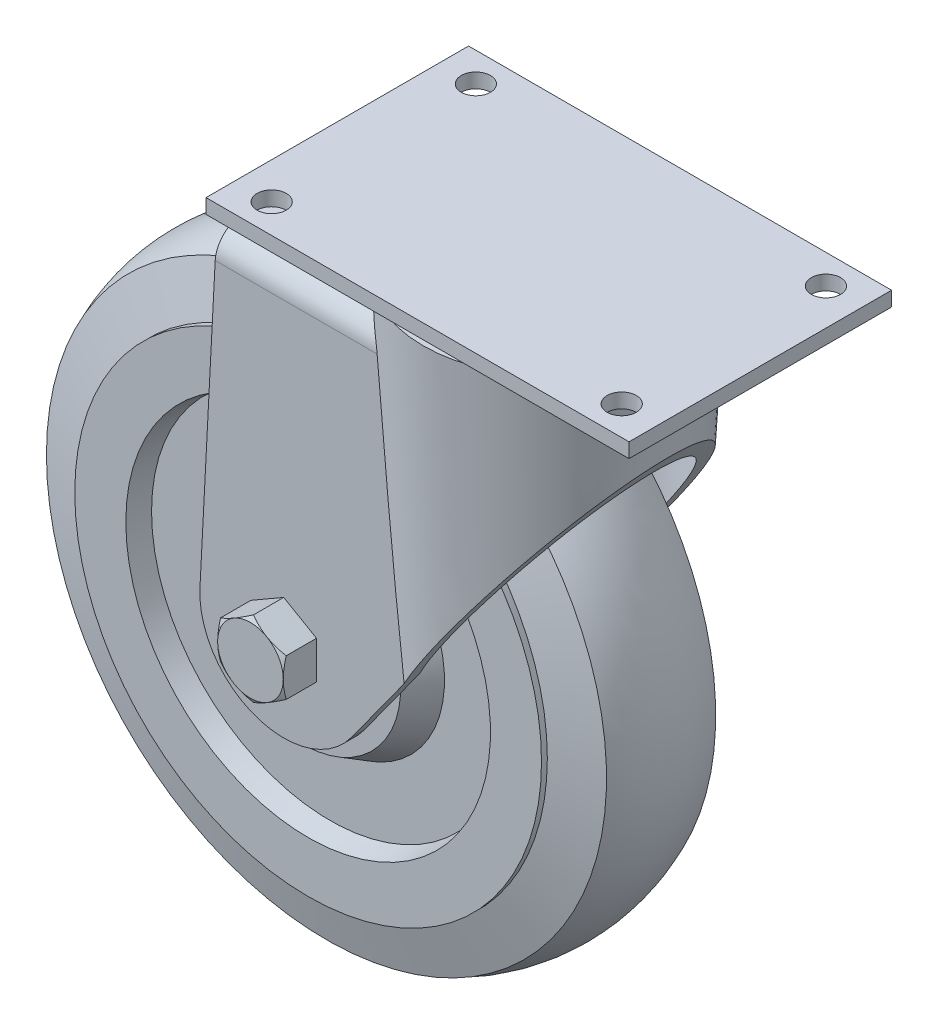
from build123d import *

# Parameters (mm, degrees)
SKETCH4_W           = 92.075
SKETCH4_H           = 57.15
SKETCH4_R           = 3.175
BOSS_EXTRUDE1_DEPTH = 3.175
SKETCH5_W           = 1.778
SKETCH5_H           = 1.143
SKETCH6_R           = 27.330023288
BOSS_EXTRUDE2_DEPTH = 140.5001
BOSS_EXTRUDE2_TAPER = 3
SKETCH8_W           = 61.093730444
SKETCH8_H           = 134.1501
BOSS_EXTRUDE3_DEPTH = 21.193125
FILLET2_R           = 6.35
SHELL1_START        = -58.315605444
SHELL1_DEPTH        = 55.537480444
CUT_EXTRUDE1_START  = -24.369939
CUT_EXTRUDE1_DEPTH  = 48.739878
SKETCH10_R          = 6.35
BOSS_EXTRUDE4_DEPTH = 39.608125
BOSS_EXTRUDE5_DEPTH = 7.239
SKETCH12_OUTSIDE_W  = 838.575
SKETCH12_OUTSIDE_H  = 838.576
SKETCH12_OUTSIDE_R  = 7.14375
CUT_EXTRUDE2_DEPTH  = 186.964821905
CUT_EXTRUDE2_DRAFT  = -60


with BuildPart() as part:
    # Sketch3 → Revolve1 (revolve)
    with BuildSketch(Plane(origin=(-36.5125, 0, 0), x_dir=(0, 0, -1), z_dir=(1, 0, 0)), mode=Mode.PRIVATE) as revolve1_sk:
        with BuildLine():
            Line((-17.145, -82.55), (-17.145, -61.11875))
            Line((-17.145, -61.11875), (-11.1125, -57.635884501))
            Line((-11.1125, -57.635884501), (-11.1125, -43.702257246))
            Line((-11.1125, -43.702257246), (-15.875, -42.8625))
            Line((-15.875, -42.8625), (-15.875, -31.75))
            Line((-15.875, -31.75), (-14.605, -31.75))
            Line((-14.605, -31.75), (-11.882636205, -21.59))
            ThreePointArc((-11.882636205, -21.59), (0, -19.05), (11.882636205, -21.59))
            Line((11.882636205, -21.59), (14.605, -31.75))
            Line((14.605, -31.75), (15.875, -31.75))
            Line((15.875, -31.75), (15.875, -42.8625))
            Line((15.875, -42.8625), (11.1125, -43.702257246))
            Line((11.1125, -43.702257246), (11.1125, -57.635884501))
            Line((11.1125, -57.635884501), (17.145, -61.11875))
            Line((17.145, -61.11875), (17.145, -82.55))
            Line((17.145, -82.55), (-17.145, -82.55))
        make_face()
    revolve(revolve1_sk.sketch.rotate(Axis((-36.5125, -82.55, 17.145), (0, 0, 1)), 90), axis=Axis((-36.5125, -82.55, 17.145), (0, 0, 1)))


with BuildPart() as body_2:
    # Sketch4 → Boss-Extrude1 (new body)
    with BuildSketch(Plane(origin=(0, 0, 0), x_dir=(1, 0, 0), z_dir=(0, 1, 0))):
        Rectangle(SKETCH4_W, SKETCH4_H)
        with Locations(Location((38.1, 22.225, 0), (0, 0, 270))):
            Circle(SKETCH4_R, mode=Mode.SUBTRACT)
        with Locations(Location((-38.1, 22.225, 0), (0, 0, 90))):
            Circle(SKETCH4_R, mode=Mode.SUBTRACT)
        with Locations(Location((38.1, -22.225, 0), (0, 0, 90))):
            Circle(SKETCH4_R, mode=Mode.SUBTRACT)
        with Locations(Location((-38.1, -22.225, 0), (0, 0, 270))):
            Circle(SKETCH4_R, mode=Mode.SUBTRACT)
    extrude(amount=-BOSS_EXTRUDE1_DEPTH)

    # Sketch5 → Revolve2 (revolve)
    with BuildSketch(Plane.XY, mode=Mode.PRIVATE) as revolve2_sk:
        with BuildLine():
            Line((0, -5.5499), (24.790023288, -5.5499))
            ThreePointArc((24.790023288, -5.5499), (23.047322881, -3.811221335), (20.66925, -3.175))
            Line((20.66925, -3.175), (0, -3.175))
            Line((0, -3.175), (0, -5.5499))
        make_face()
        with Locations((24.54275, -10.033)):
            Rectangle(SKETCH5_W, SKETCH5_H)
    revolve(revolve2_sk.sketch.rotate(Axis((0, -3.175, 0), (0, -1, 0)), 180), axis=Axis((0, -3.175, 0), (0, -1, 0)))


with BuildPart() as revolve2_piece_1:
    # of the separate pieces the step leaves, piece 1, a body of its own (revolve2_pieces)
    add(body_2.part.solids().sort_by_distance((-46.0375, 0, -28.575))[0])


with BuildPart() as revolve2_piece_2:
    # of the separate pieces the step leaves, piece 2, a body of its own (revolve2_pieces)
    add(body_2.part.solids().sort_by_distance((-25.43175, -10.6045, 0))[0])


with BuildPart() as body_4:
    # Sketch6 → Boss-Extrude2 (new body)
    with BuildSketch(Plane.XZ.offset(5.5499)):
        Circle(SKETCH6_R)
    extrude(amount=BOSS_EXTRUDE2_DEPTH, taper=BOSS_EXTRUDE2_TAPER)


with BuildPart() as body_5:
    # Sketch8 → Boss-Extrude3 (new, symmetric)
    with BuildSketch(Plane.XY):
        with Locations((-30.546865222, -78.97495)):
            Rectangle(SKETCH8_W, SKETCH8_H)
    extrude(amount=BOSS_EXTRUDE3_DEPTH, both=True)

    # Fillet2
    fillet2_edges = [body_5.edges().sort_by_distance(p)[0] for p in [
        (-30.546865222, -11.8999, 21.193125),
        (-30.546865222, -11.8999, -21.193125),
    ]]
    fillet(fillet2_edges, radius=FILLET2_R)

    # Combine1: union body 4
    add(body_4.part)

    # Shell1: read off the stored shape, not the designer's step
    # Shell1 outline → Shell1 (cut)
    with BuildSketch(Plane.YZ.offset(SHELL1_START)):
        with BuildLine():
            Line((-14.678025, -14.843125), (-14.678025, 14.843125))
            ThreePointArc((-14.678025, 14.843125), (-15.724202966, 17.368822034), (-18.2499, 18.415))
            Line((-18.2499, 18.415), (-146.05, 18.415))
            Line((-146.05, 18.415), (-146.05, -18.415))
            Line((-146.05, -18.415), (-18.2499, -18.415))
            ThreePointArc((-18.2499, -18.415), (-15.724202966, -17.368822034), (-14.678025, -14.843125))
        make_face()
    extrude(amount=SHELL1_DEPTH, mode=Mode.SUBTRACT)

    # Shell1 2 outline → Shell1 2 (revolve, cut)
    with BuildSketch(Plane.XY):
        Polygon((24.402490377, -8.328025), (0, -8.328025), (0, -146.05), (17.184787509, -146.05), align=None)
    revolve(axis=Axis((0, 0, 0), (0, 1, 0)), mode=Mode.SUBTRACT)

    # Sketch9 → Cut-Extrude1 (cut)
    with BuildSketch(Plane.XY.offset(CUT_EXTRUDE1_START)):
        with BuildLine():
            Line((240.810457237, 269.335724208), (27.985680083, -24.5999))
            Line((27.985680083, -24.5999), (-21.725392952, -93.256639492))
            ThreePointArc((-21.725392952, -93.256639492), (-42.592518727, -99.764065073), (-54.743730444, -81.594541699))
            Line((-54.743730444, -81.594541699), (-51.091189045, -11.8999))
            Line((-51.091189045, -11.8999), (-32.098749804, 350.497429186))
            Line((-32.098749804, 350.497429186), (-238.989276721, -345.179548778))
            Line((-238.989276721, -345.179548778), (33.919930319, -426.341253756))
            Line((33.919930319, -426.341253756), (240.810457237, 269.335724208))
        make_face()
    extrude(amount=CUT_EXTRUDE1_DEPTH, mode=Mode.SUBTRACT)


with BuildPart() as body_5_2:
    # Sketch10 → Boss-Extrude4 (new body)
    with BuildSketch(Plane.XY.offset(-18.415)):
        with Locations(Location((-36.5125, -82.55, 0), (0, 0, 180))):
            Circle(SKETCH10_R)
    extrude(amount=BOSS_EXTRUDE4_DEPTH)


with BuildPart() as body_6:
    # Sketch11 → Boss-Extrude5 (new body)
    with BuildSketch(Plane.XY.offset(21.193125)):
        Polygon((-36.5125, -90.798891971), (-29.36875, -86.674445986), (-29.36875, -78.425554014), (-36.5125, -74.301108029), (-43.65625, -78.425554014), (-43.65625, -86.674445986), align=None)
    extrude(amount=BOSS_EXTRUDE5_DEPTH)


with BuildPart() as cut_extrude2_tool:
    # Sketch12 outside → Cut-Extrude2 (with draft: the straight prism first)
    with BuildSketch(Plane.XY.offset(28.432125)):
        with Locations((-26.9875, -73.025)):
            Rectangle(SKETCH12_OUTSIDE_W, SKETCH12_OUTSIDE_H)
        with Locations((-36.5125, -82.55)):
            Circle(SKETCH12_OUTSIDE_R, mode=Mode.SUBTRACT)
    extrude(amount=-CUT_EXTRUDE2_DEPTH)
    # Cut-Extrude2: the draft: its side faces are tilted about the plane it starts from
    cut_extrude2_sides = [cut_extrude2_tool.faces().sort_by_distance(p)[0] for p in [
        (-26.9875, -492.313, -65.050285953),
        (392.3, -73.025, -65.050285953),
        (-26.9875, 346.263, -65.050285953),
        (-446.275, -73.025, -65.050285953),
        (-43.65625, -82.55, -65.050285953),
    ]]
    draft(cut_extrude2_sides, Plane.XY.offset(28.432125), CUT_EXTRUDE2_DRAFT)


with BuildPart() as body_6_1:
    add(body_6.part)

    # Cut-Extrude2: cut by cut_extrude2_tool
    add(cut_extrude2_tool.part, mode=Mode.SUBTRACT)


solid = Compound([part.part, revolve2_piece_1.part, revolve2_piece_2.part, body_5.part, body_5_2.part, body_6_1.part])
